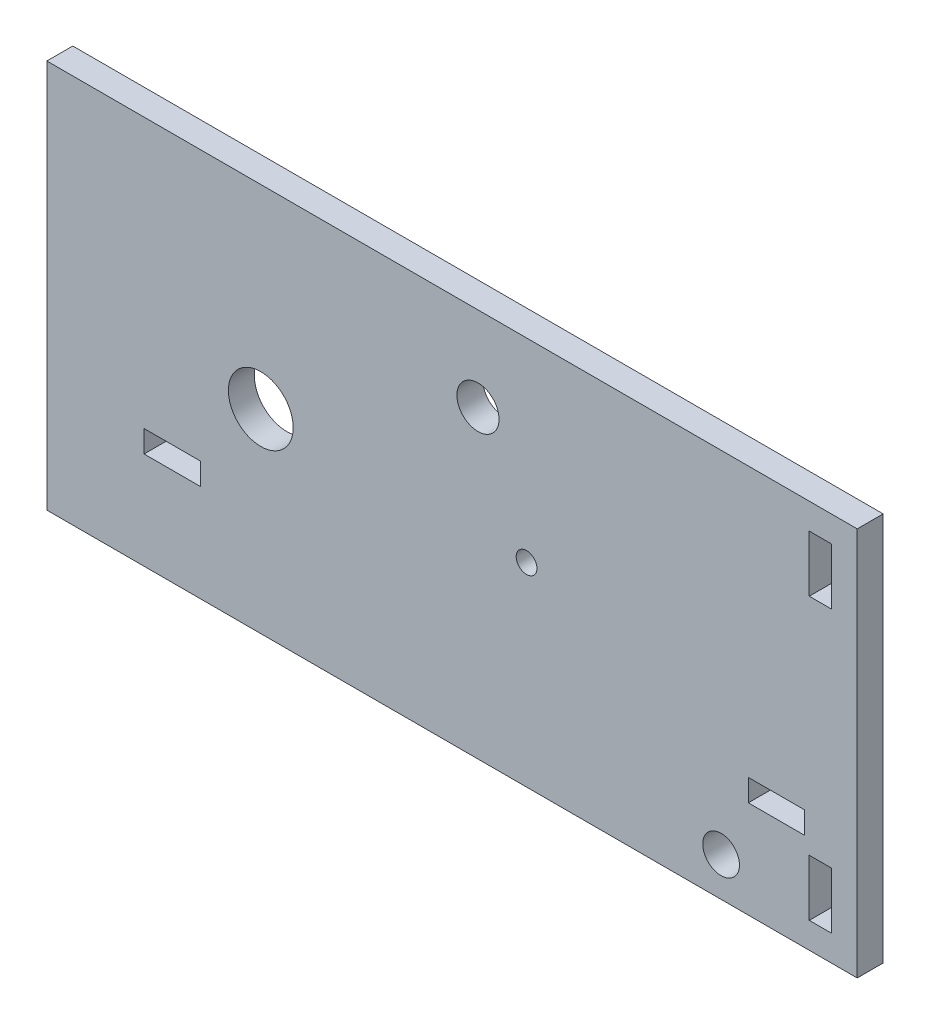
from build123d import *

# Parameters (mm, degrees)
SKETCH1_W               = 121
SKETCH1_H               = 60
SKETCH1_R               = 5
SKETCH1_R_2             = 3.25
SKETCH1_R_3             = 2.83
SKETCH1_R_4             = 1.6
SKETCH1_W_2             = 8.7
SKETCH1_H_2             = 3.4
BOSS_EXTRUDE1_DEPTH     = 4
SKETCH2_W               = 4
SKETCH2_H               = 60
BOSS_EXTRUDE2_DEPTH     = 4
CUT_EXTRUDE2_DEPTH      = 85.599054368
CUT_EXTRUDE2_DEPTH_BACK = 85.599054368
SKETCH3_W               = 3.4
SKETCH3_H               = 8.7


with BuildPart() as part:
    # Sketch1 → Boss-Extrude1 (new body)
    with BuildSketch(Plane.XY):
        with Locations((-18.5, 0)):
            Rectangle(SKETCH1_W, SKETCH1_H)
        with Locations((-46, 0)):
            Circle(SKETCH1_R, mode=Mode.SUBTRACT)
        with Locations((-12.5, 17)):
            Circle(SKETCH1_R_2, mode=Mode.SUBTRACT)
        with Locations((25, -24)):
            Circle(SKETCH1_R_3, mode=Mode.SUBTRACT)
        with Locations((-5, 0)):
            Circle(SKETCH1_R_4, mode=Mode.SUBTRACT)
        with Locations((-59.65, -13.3)):
            Rectangle(SKETCH1_W_2, SKETCH1_H_2, mode=Mode.SUBTRACT)
        with Locations((33.55, -13.3)):
            Rectangle(SKETCH1_W_2, SKETCH1_H_2, mode=Mode.SUBTRACT)
    extrude(amount=BOSS_EXTRUDE1_DEPTH)

    # Sketch2 → Boss-Extrude2 (add)
    with BuildSketch(Plane.XY):
        with Locations((44, 0)):
            Rectangle(SKETCH2_W, SKETCH2_H)
    extrude(amount=BOSS_EXTRUDE2_DEPTH)

    # Sketch3 → Cut-Extrude2 (cut, two sides: drawn at the far end of the back side and taken through both)
    with BuildSketch(Plane.XY.offset(-CUT_EXTRUDE2_DEPTH_BACK)):
        with Locations((40.3, 21.65)):
            Rectangle(SKETCH3_W, SKETCH3_H)
        with Locations((40.3, -21.65)):
            Rectangle(SKETCH3_W, SKETCH3_H)
    extrude(amount=CUT_EXTRUDE2_DEPTH + CUT_EXTRUDE2_DEPTH_BACK, mode=Mode.SUBTRACT)


solid = part.part
